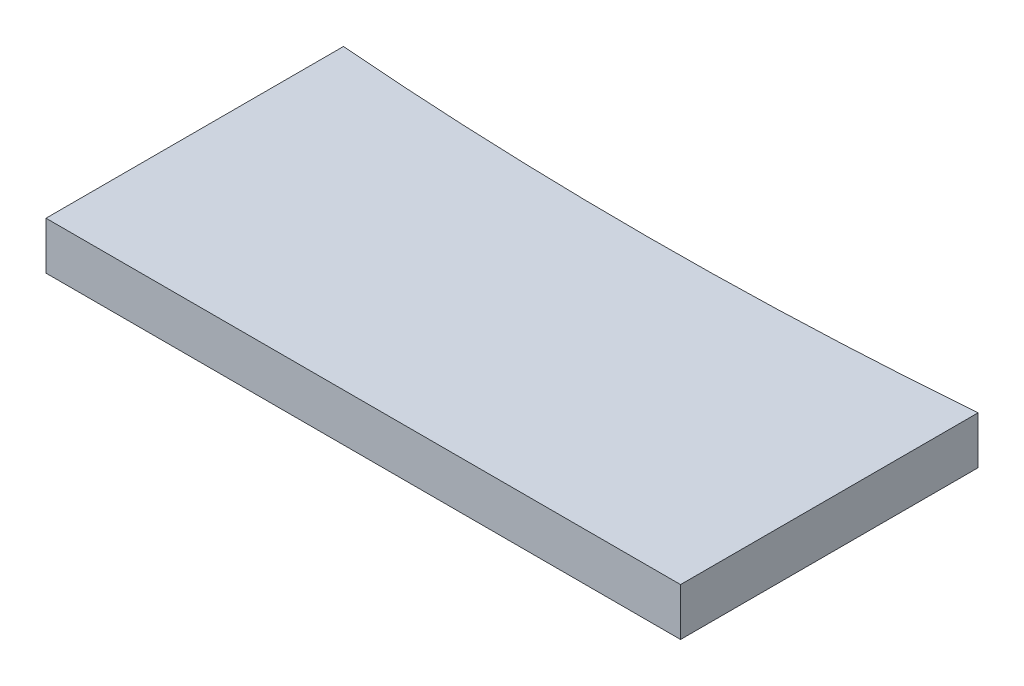
from build123d import *

# Parameters (mm, degrees)
BOSS_EXTRUDE1_DEPTH = 0.762


with BuildPart() as part:
    # Sketch1 → Boss-Extrude1 (new body)
    with BuildSketch(Plane(origin=(0, 0, 0), x_dir=(1, 0, 0), z_dir=(0, 1, 0))):
        with BuildLine():
            ThreePointArc((5.08, -63.296473835), (0, -63.5), (-5.08, -63.296473835))
            Line((-5.08, -63.296473835), (-5.08, -68.058973835))
            Line((-5.08, -68.058973835), (5.08, -68.058973835))
            Line((5.08, -68.058973835), (5.08, -63.296473835))
        make_face()
    extrude(amount=BOSS_EXTRUDE1_DEPTH)


solid = part.part
